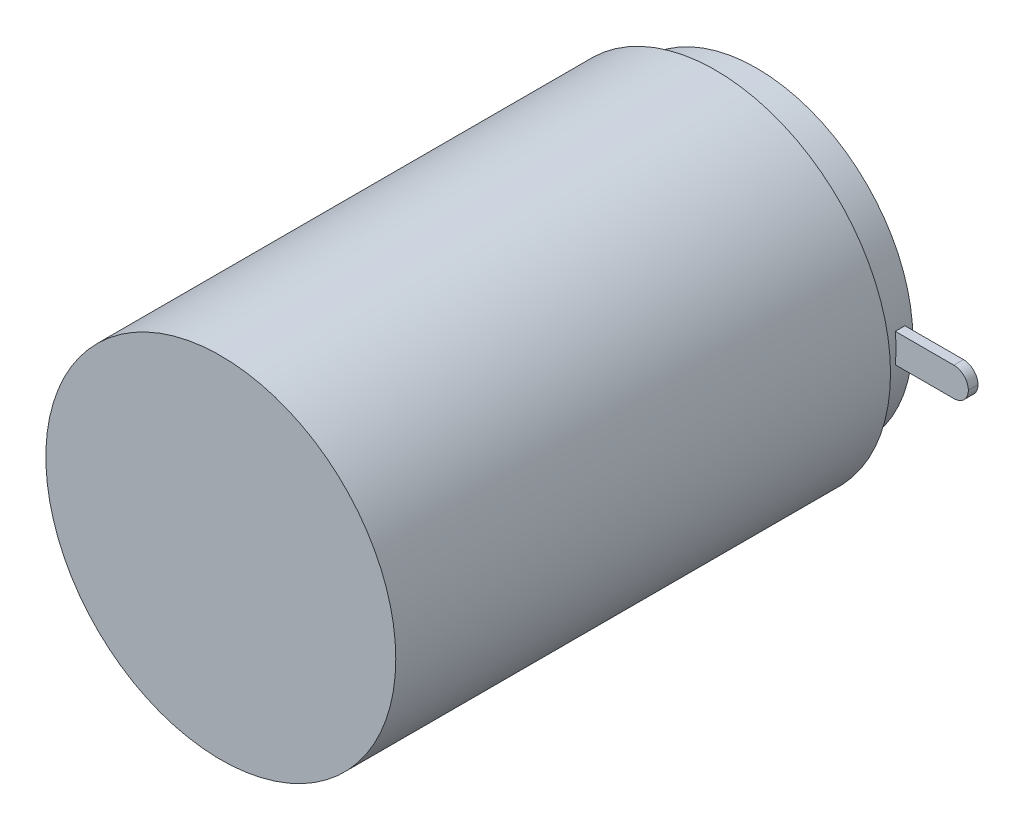
from build123d import *

# Parameters (mm, degrees)
ESQUISSE1_R             = 14.5
BOSS_EXTRU_1_DEPTH      = 41
ESQUISSE2_R             = 12.95
BOSS_EXTRU_2_DEPTH      = 3.4
BOSS_EXTRU_3_DEPTH      = 6
BOSS_EXTRU_3_DEPTH_BACK = 1
ESQUISSE3_W             = 0.8
ESQUISSE3_H             = 2.4
BOSS_EXTRU_4_DEPTH      = 6
BOSS_EXTRU_4_DEPTH_BACK = 1
ESQUISSE4_W             = 0.8
ESQUISSE4_H             = 2.4
CONG_1_R                = 1.2


with BuildPart() as part:
    # Esquisse1 → Boss.-Extru.1 (new body)
    with BuildSketch(Plane.XY):
        Circle(ESQUISSE1_R)
    extrude(amount=BOSS_EXTRU_1_DEPTH)

    # Esquisse2 → Boss.-Extru.2 (add)
    with BuildSketch(Plane(origin=(0, 0, 0), x_dir=(-1, 0, 0), z_dir=(0, 0, -1))):
        with Locations(Location((0, 0, 0), (0, 0, 180))):
            Circle(ESQUISSE2_R)
    extrude(amount=BOSS_EXTRU_2_DEPTH)

    # Esquisse3 → Boss.-Extru.3 (add, two sides: drawn at the far end of the back side and taken through both)
    with BuildSketch(Plane(origin=(12.95, 0, 0), x_dir=(0, 0, -1), z_dir=(1, 0, 0)).offset(-BOSS_EXTRU_3_DEPTH_BACK)):
        with Locations((2.4, 0)):
            Rectangle(ESQUISSE3_W, ESQUISSE3_H)
    extrude(amount=BOSS_EXTRU_3_DEPTH + BOSS_EXTRU_3_DEPTH_BACK)

    # Esquisse4 → Boss.-Extru.4 (add, two sides: drawn at the far end of the back side and taken through both)
    with BuildSketch(Plane.ZY.offset(12.95).offset(-BOSS_EXTRU_4_DEPTH_BACK)):
        with Locations((-2.4, 0)):
            Rectangle(ESQUISSE4_W, ESQUISSE4_H)
    extrude(amount=BOSS_EXTRU_4_DEPTH + BOSS_EXTRU_4_DEPTH_BACK)

    # Congé1
    cong_1_edges = [part.edges().sort_by_distance(p)[0] for p in [
        (18.95, -1.2, -2.4),
        (18.95, 1.2, -2.4),
        (-18.95, -1.2, -2.4),
        (-18.95, 1.2, -2.4),
    ]]
    fillet(cong_1_edges, radius=CONG_1_R - 0.0001)  # a hair under: the kernel refuses the full size


solid = part.part
